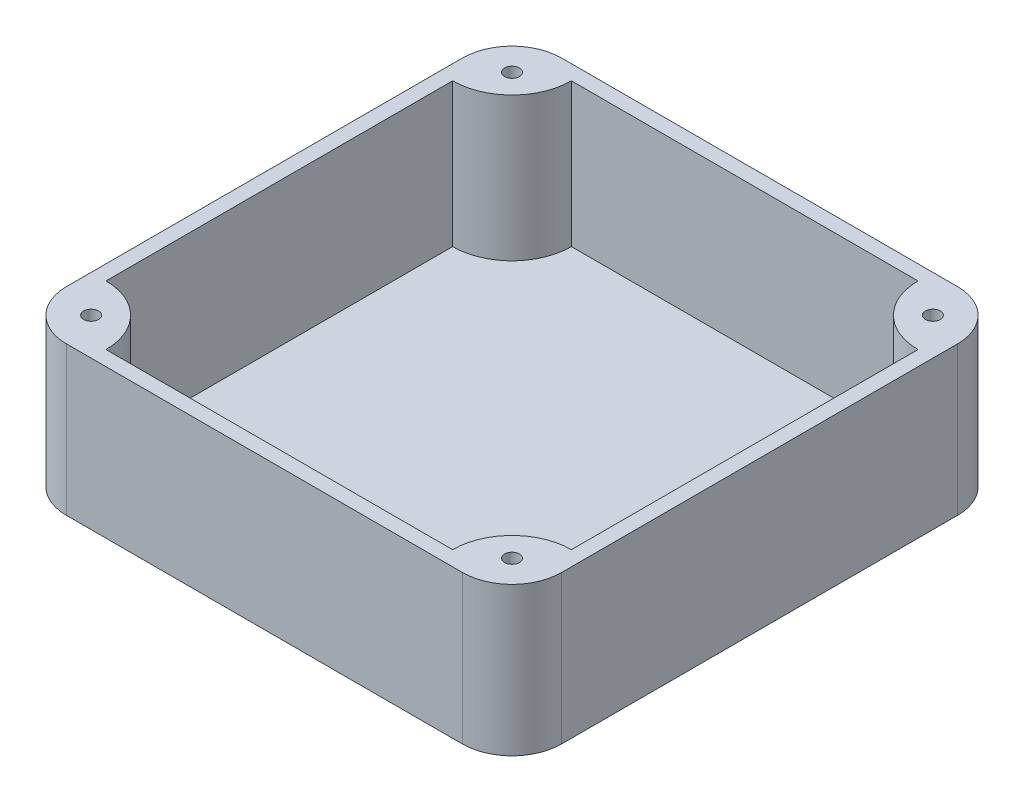
from build123d import *

# Parameters (mm, degrees)
SKIZZE1_R                       = 1.5
AUFSATZ_LINEAR_AUSTRAGEN1_DEPTH = 30
AUFSATZ_LINEAR_AUSTRAGEN2_DEPTH = 1
VERRUNDUNG1_R                   = 10
SKIZZE1_4_R                     = 1.5
AUFSATZ_LINEAR_AUSTRAGEN3_DEPTH = 1
VERRUNDUNG2_R                   = 12


with BuildPart() as part:
    # Skizze1 → Aufsatz-Linear austragen1 (new body)
    with BuildSketch(Plane(origin=(0, 0, 0), x_dir=(1, 0, 0), z_dir=(0, 1, 0))):
        Polygon((-50, 50), (50, 50), (50, -50), (-50, -50), (-50, 35), align=None)
        with Locations(Location((42.5, 42.5, 0), (0, 0, 270))):
            Circle(SKIZZE1_R, mode=Mode.SUBTRACT)
        with Locations(Location((-42.5, 42.5, 0), (0, 0, 270))):
            Circle(SKIZZE1_R, mode=Mode.SUBTRACT)
        with Locations(Location((42.5, -42.5, 0), (0, 0, 270))):
            Circle(SKIZZE1_R, mode=Mode.SUBTRACT)
        with Locations(Location((-42.5, -42.5, 0), (0, 0, 270))):
            Circle(SKIZZE1_R, mode=Mode.SUBTRACT)
        Polygon((-47, -35), (-35, -35), (-35, -47), (35, -47), (35, -35), (47, -35), (47, 35), (35, 35), (35, 47), (-35, 47), (-35, 35), (-47, 35), align=None, mode=Mode.SUBTRACT)
    extrude(amount=AUFSATZ_LINEAR_AUSTRAGEN1_DEPTH)

    # Skizze1<3> → Aufsatz-Linear austragen2 (add)
    with BuildSketch(Plane(origin=(0, 0, 0), x_dir=(1, 0, 0), z_dir=(0, 1, 0))):
        Polygon((-47, -35), (-47, 35), (-35, 35), (-35, 47), (35, 47), (35, 35), (47, 35), (47, -35), (35, -35), (35, -47), (-35, -47), (-35, -35), align=None)
    extrude(amount=AUFSATZ_LINEAR_AUSTRAGEN2_DEPTH)

    # Verrundung1
    verrundung1_edges = [part.edges().sort_by_distance(p)[0] for p in [
        (50, 15, -50),
        (50, 15, 50),
        (-50, 15, 50),
        (-50, 15, -50),
    ]]
    fillet(verrundung1_edges, radius=VERRUNDUNG1_R)

    # Skizze1<4> → Aufsatz-Linear austragen3 (add)
    with BuildSketch(Plane(origin=(0, 0, 0), x_dir=(1, 0, 0), z_dir=(0, 1, 0))):
        with Locations(Location((-42.5, 42.5, 0), (0, 0, 270))):
            Circle(SKIZZE1_4_R)
        with Locations(Location((-42.5, -42.5, 0), (0, 0, 270))):
            Circle(SKIZZE1_4_R)
        with Locations(Location((42.5, -42.5, 0), (0, 0, 270))):
            Circle(SKIZZE1_4_R)
        with Locations(Location((42.5, 42.5, 0), (0, 0, 270))):
            Circle(SKIZZE1_4_R)
    extrude(amount=AUFSATZ_LINEAR_AUSTRAGEN3_DEPTH)

    # Verrundung2
    verrundung2_edges = [part.edges().sort_by_distance(p)[0] for p in [
        (35, 15.5, 35),
        (-35, 15.5, 35),
        (35, 15.5, -35),
        (-35, 15.5, -35),
    ]]
    fillet(verrundung2_edges, radius=VERRUNDUNG2_R - 0.0001)  # a hair under: the kernel refuses the full size


solid = part.part
